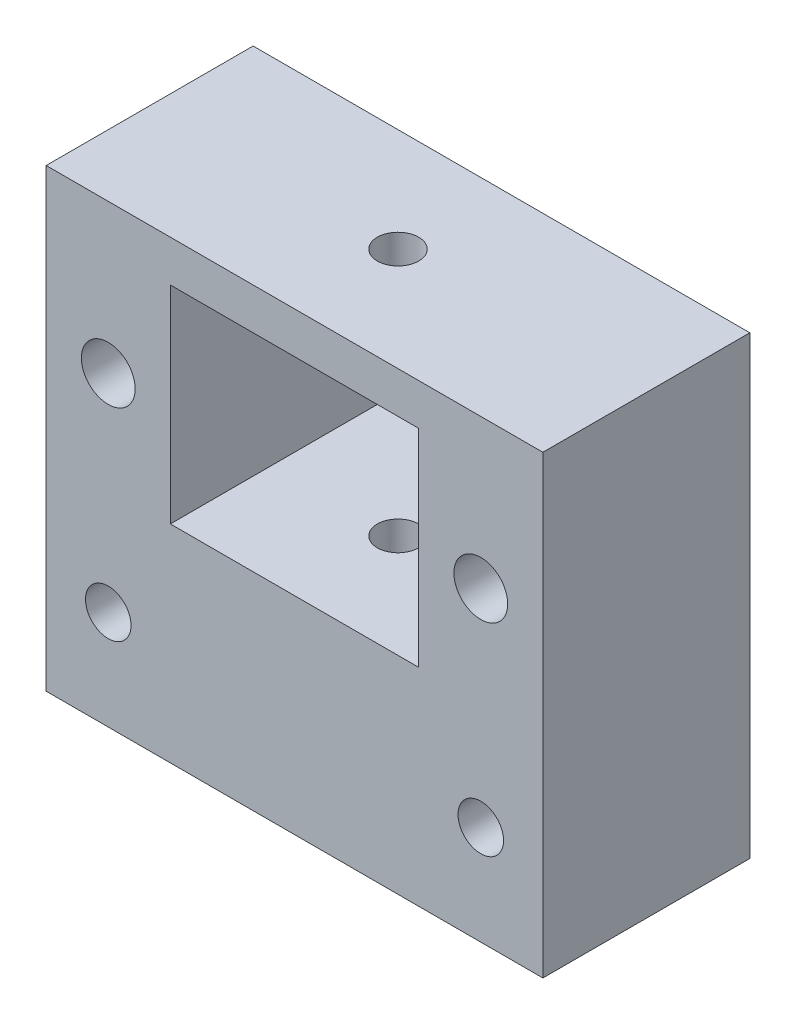
from build123d import *

# Parameters (mm, degrees)
SKETCH2_W           = 60
SKETCH2_H           = 25
BOSS_EXTRUDE1_DEPTH = 55
CUT_EXTRUDE1_REACH  = 87.147
SKETCH3_W           = 30
SKETCH3_H           = 25
SKETCH4_R           = 2.5
CUT_EXTRUDE2_DEPTH  = 86.14693183
SKETCH5_R           = 3.25
SKETCH5_R_2         = 2.75
CUT_EXTRUDE3_DEPTH  = 86.14693183
SKETCH9_R           = 4.45
CUT_EXTRUDE7_DEPTH  = 11.5


with BuildPart() as part:
    # Sketch2 → Boss-Extrude1 (new body)
    with BuildSketch(Plane(origin=(0, 0, 0), x_dir=(1, 0, 0), z_dir=(0, 1, 0))):
        with Locations((30, 12.5)):
            Rectangle(SKETCH2_W, SKETCH2_H)
    extrude(amount=BOSS_EXTRUDE1_DEPTH)

    # Sketch3 → Cut-Extrude1 (cut, up to next)
    with BuildSketch(Plane.XY, mode=Mode.PRIVATE) as cut_extrude1_sk1:
        with Locations((30, 37.5)):
            Rectangle(SKETCH3_W, SKETCH3_H)
    cut_extrude1_tool1 = extrude(cut_extrude1_sk1.sketch, amount=-CUT_EXTRUDE1_REACH, mode=Mode.PRIVATE) & part.part
    add(cut_extrude1_tool1.solids().sort_by_distance((30, 37.5, 0))[0], mode=Mode.SUBTRACT)

    # Sketch4 → Cut-Extrude2 (cut, through all)
    with BuildSketch(Plane(origin=(0, 55, 0), x_dir=(1, 0, 0), z_dir=(0, 1, 0))):
        with Locations((30, 12.5)):
            Circle(SKETCH4_R)
    extrude(amount=-CUT_EXTRUDE2_DEPTH, mode=Mode.SUBTRACT)

    # Sketch5 → Cut-Extrude3 (cut, through all)
    with BuildSketch(Plane.XY):
        with Locations((7.5, 37)):
            Circle(SKETCH5_R)
        with Locations((7.5, 12)):
            Circle(SKETCH5_R_2)
        with Locations((52.5, 12)):
            Circle(SKETCH5_R_2)
        with Locations((52.5, 37)):
            Circle(SKETCH5_R)
    extrude(amount=-CUT_EXTRUDE3_DEPTH, mode=Mode.SUBTRACT)

    # Sketch9 → Cut-Extrude7 (cut)
    with BuildSketch(Plane(origin=(0, 0, -25), x_dir=(-1, 0, 0), z_dir=(0, 0, -1))):
        with Locations((-52.5, 37)):
            Circle(SKETCH9_R)
        with Locations((-7.5, 37)):
            Circle(SKETCH9_R)
    extrude(amount=-CUT_EXTRUDE7_DEPTH, mode=Mode.SUBTRACT)


solid = part.part
